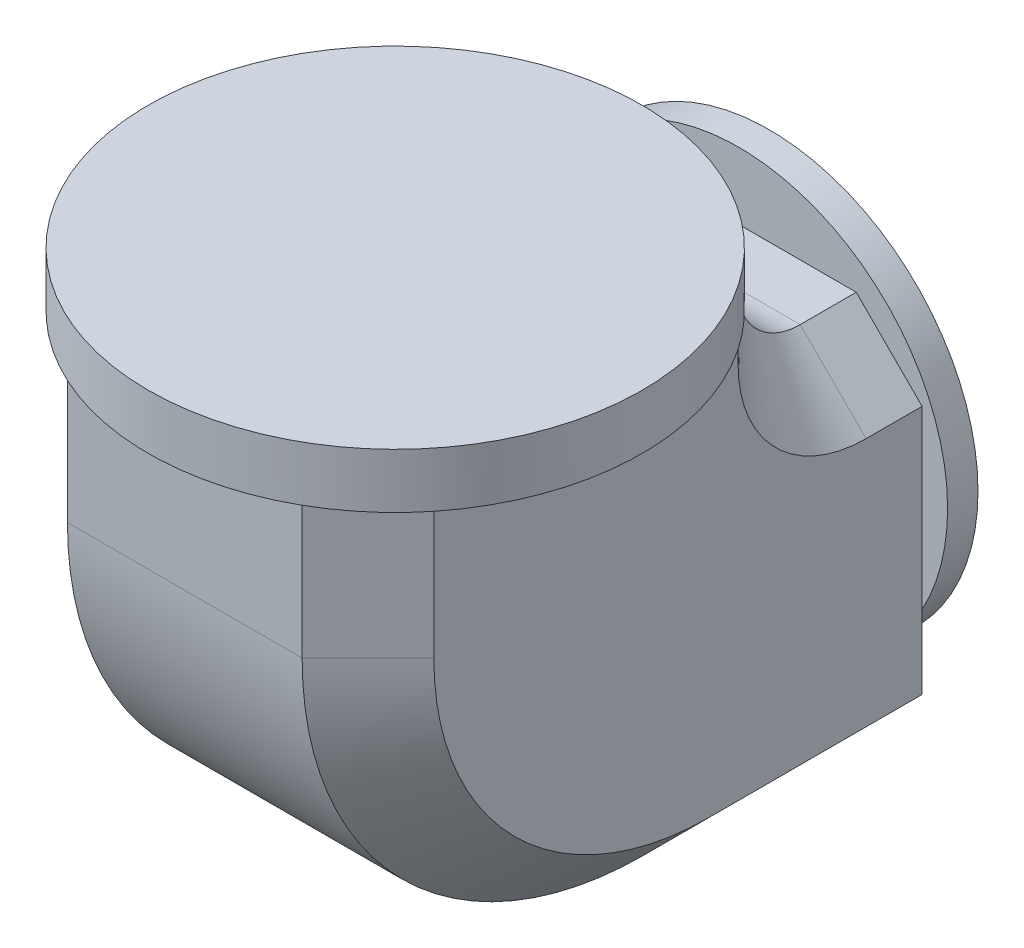
from build123d import *

# Parameters (mm, degrees)
SKETCH1_R      = 4.427139884
EXTRUDE1_DEPTH = 0.644658235
EXTRUDE2_DEPTH = 3.885892792
SKETCH3_R      = 5.238234522
EXTRUDE3_DEPTH = 1.161266807
CHAMFER1_SIZE  = 1.397


with BuildPart() as part:
    # Sketch1 → Extrude1 (new body)
    with BuildSketch(Plane.XY):
        with Locations((0, 20.585351579)):
            Circle(SKETCH1_R)
    extrude(amount=EXTRUDE1_DEPTH)

    # Sketch2 → Extrude2 (add, symmetric)
    with BuildSketch(Plane(origin=(0, 0, 0), x_dir=(0, 0, -1), z_dir=(1, 0, 0))):
        with BuildLine():
            Line((-0.644658235, 15.505020105), (-0.644658235, 23.59311727))
            Line((-0.644658235, 23.59311727), (-1.832887116, 23.59311727))
            ThreePointArc((-1.832887116, 23.59311727), (-2.764654054, 23.979067772), (-3.150604557, 24.910834711))
            Line((-3.150604557, 24.910834711), (-3.150604557, 25.650777017))
            Line((-3.150604557, 25.650777017), (-12.398423576, 25.650777017))
            Line((-12.398423576, 25.650777017), (-12.398423576, 22.749820493))
            ThreePointArc((-12.398423576, 22.749820493), (-10.27647067, 17.62697301), (-5.153623188, 15.505020105))
            Line((-5.153623188, 15.505020105), (-0.644658235, 15.505020105))
        make_face()
    extrude(amount=EXTRUDE2_DEPTH, both=True)

    # Sketch3 → Extrude3 (add)
    with BuildSketch(Plane(origin=(0, 25.650777017, 0), x_dir=(1, 0, 0), z_dir=(0, 1, 0))):
        with Locations(Location((0, -7.934882504, 0), (0, 0, 65.970774096))):
            Circle(SKETCH3_R)
    extrude(amount=EXTRUDE3_DEPTH)

    # Chamfer1
    # the kernel refuses this chamfer: 1.397 mm, written as the material it takes off along each edge
    with BuildSketch(Plane(origin=(-3.885892792, 24.910834711, 1.832887116), x_dir=(0, -1, 0), z_dir=(0, 0, -1))) as chamfer1_piece_1:
        Polygon((1.317717441 + CHAMFER1_SIZE, 0), (1.317717441, -CHAMFER1_SIZE), (1.317717441, 0), align=None)
    revolve(axis=Axis((-3.885892792, 24.910834711, 1.832887116), (-1, 0, 0)), revolution_arc=90, mode=Mode.SUBTRACT)
    with BuildSketch(Plane(origin=(-3.885892792, 24.910834711, 3.150604557), x_dir=(-0.027495876610586344, 0, 0.9996219169112966), z_dir=(0, 1, 0))) as chamfer1_piece_2:
        Polygon((CHAMFER1_SIZE * 0.999621916911, CHAMFER1_SIZE * 0.0274958766106), (-CHAMFER1_SIZE * 0.0274958766106, CHAMFER1_SIZE * 0.999621916911), (0, 0), align=None)
    extrude(amount=0.739942306, mode=Mode.SUBTRACT)
    with BuildSketch(Plane(origin=(-3.885892792, 25.650777017, 12.398423576), x_dir=(-0.027495876610586365, 0, -0.9996219169112968), z_dir=(0, -1, 0))) as chamfer1_piece_3:
        Polygon((CHAMFER1_SIZE * 0.999621916911, CHAMFER1_SIZE * 0.0274958766106), (-CHAMFER1_SIZE * 0.0274958766106, CHAMFER1_SIZE * 0.999621916911), (0, 0), align=None)
    extrude(amount=2.900956524, mode=Mode.SUBTRACT)
    with BuildSketch(Plane(origin=(-3.885892792, 22.749820493, 5.153623188), x_dir=(0, 0, 1), z_dir=(0, 1, 0))) as chamfer1_piece_4:
        Polygon((7.244800387 - CHAMFER1_SIZE, 0), (7.244800387, CHAMFER1_SIZE), (7.244800387, 0), align=None)
    revolve(axis=Axis((-3.885892792, 22.749820493, 5.153623188), (1, 0, 0)), revolution_arc=90, mode=Mode.SUBTRACT)
    with BuildSketch(Plane(origin=(3.885892792, 15.505020105, 5.153623188), x_dir=(0.027495876610586393, 0.9996219169112966, 0), z_dir=(0, 0, -1)), Plane(origin=(-3.885892792, 15.505020105, 5.153623188), x_dir=(0.9996219169112968, -0.027495876610586046, 0), z_dir=(0, 0, -1))) as chamfer1_piece_5:
        Polygon((CHAMFER1_SIZE * 0.999621916911, -CHAMFER1_SIZE * 0.0274958766106), (-CHAMFER1_SIZE * 0.0274958766106, -CHAMFER1_SIZE * 0.999621916911), (0, 0), align=None)
    extrude(amount=8.101606087, mode=Mode.SUBTRACT)
    with BuildSketch(Plane(origin=(3.885892792, 23.59311727, 0.644658235), x_dir=(0.027495876610586393, -0.9996219169112966, 0), z_dir=(0, 0, 1))) as chamfer1_piece_6:
        Polygon((CHAMFER1_SIZE * 0.999621916911, -CHAMFER1_SIZE * 0.0274958766106), (-CHAMFER1_SIZE * 0.0274958766106, -CHAMFER1_SIZE * 0.999621916911), (0, 0), align=None)
    extrude(amount=1.188228881, mode=Mode.SUBTRACT)
    with BuildSketch(Plane(origin=(3.885892792, 24.910834711, 1.832887116), x_dir=(0, -1, 0), z_dir=(0, 0, -1))) as chamfer1_piece_7:
        Polygon((1.317717441 + CHAMFER1_SIZE, 0), (1.317717441, CHAMFER1_SIZE), (1.317717441, 0), align=None)
    revolve(axis=Axis((3.885892792, 24.910834711, 1.832887116), (-1, 0, 0)), revolution_arc=90, mode=Mode.SUBTRACT)
    with BuildSketch(Plane(origin=(3.885892792, 24.910834711, 3.150604557), x_dir=(0.027495876610586344, 0, 0.9996219169112966), z_dir=(0, 1, 0))) as chamfer1_piece_8:
        Polygon((CHAMFER1_SIZE * 0.999621916911, -CHAMFER1_SIZE * 0.0274958766106), (-CHAMFER1_SIZE * 0.0274958766106, -CHAMFER1_SIZE * 0.999621916911), (0, 0), align=None)
    extrude(amount=0.739942306, mode=Mode.SUBTRACT)
    with BuildSketch(Plane(origin=(3.885892792, 25.650777017, 12.398423576), x_dir=(0.027495876610586365, 0, -0.9996219169112968), z_dir=(0, -1, 0))) as chamfer1_piece_9:
        Polygon((CHAMFER1_SIZE * 0.999621916911, -CHAMFER1_SIZE * 0.0274958766106), (-CHAMFER1_SIZE * 0.0274958766106, -CHAMFER1_SIZE * 0.999621916911), (0, 0), align=None)
    extrude(amount=2.900956524, mode=Mode.SUBTRACT)
    with BuildSketch(Plane(origin=(3.885892792, 22.749820493, 5.153623188), x_dir=(0, 0, 1), z_dir=(0, 1, 0))) as chamfer1_piece_10:
        Polygon((7.244800387 - CHAMFER1_SIZE, 0), (7.244800387, -CHAMFER1_SIZE), (7.244800387, 0), align=None)
    revolve(axis=Axis((3.885892792, 22.749820493, 5.153623188), (1, 0, 0)), revolution_arc=90, mode=Mode.SUBTRACT)
    with BuildSketch(Plane(origin=(-3.885892792, 23.59311727, 0.644658235), x_dir=(-0.027495876610586393, -0.9996219169112966, 0), z_dir=(0, 0, 1))) as chamfer1_piece_11:
        Polygon((CHAMFER1_SIZE * 0.999621916911, CHAMFER1_SIZE * 0.0274958766106), (-CHAMFER1_SIZE * 0.0274958766106, CHAMFER1_SIZE * 0.999621916911), (0, 0), align=None)
    extrude(amount=1.188228881, mode=Mode.SUBTRACT)


solid = part.part
